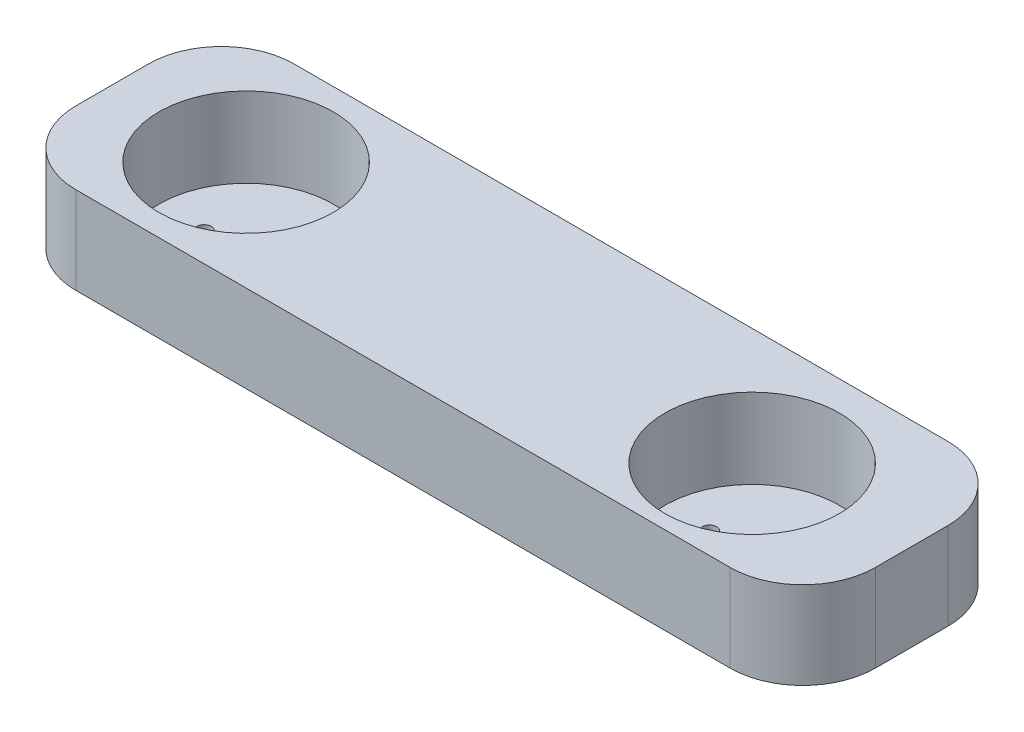
from build123d import *

# Parameters (mm, degrees)
SKETCH1_W           = 110
SKETCH1_H           = 30
BOSS_EXTRUDE1_DEPTH = 12
FILLET1_R           = 10
FILLET2_R           = 10
SKETCH9_R           = 12
CUT_EXTRUDE5_DEPTH  = 11
SKETCH13_R          = 12
CUT_EXTRUDE7_DEPTH  = 11
SKETCH15_R          = 3.43
SKETCH15_R_2        = 1
CUT_EXTRUDE8_DEPTH  = 123.394479271
SKETCH16_R          = 3.43
SKETCH16_R_2        = 1
CUT_EXTRUDE9_DEPTH  = 123.394479271


with BuildPart() as part:
    # Sketch1 → Boss-Extrude1 (new body)
    with BuildSketch(Plane(origin=(0, 0, 0), x_dir=(1, 0, 0), z_dir=(0, 1, 0))):
        with Locations((5.385430756, 3.53837453)):
            Rectangle(SKETCH1_W, SKETCH1_H)
    extrude(amount=BOSS_EXTRUDE1_DEPTH)

    # Fillet1
    fillet1_edges = [part.edges().sort_by_distance(p)[0] for p in [
        (-49.614569244, 6, -18.53837453),
        (-49.614569244, 6, 11.46162547),
    ]]
    fillet(fillet1_edges, radius=FILLET1_R)

    # Fillet2
    fillet2_edges = [part.edges().sort_by_distance(p)[0] for p in [
        (60.385430756, 6, -18.53837453),
        (60.385430756, 6, 11.46162547),
    ]]
    fillet(fillet2_edges, radius=FILLET2_R)

    # Sketch9 → Cut-Extrude5 (cut)
    with BuildSketch(Plane(origin=(0, 12, 0), x_dir=(1, 0, 0), z_dir=(0, 1, 0))):
        with Locations((-31.195762423, 3.53837453)):
            Circle(SKETCH9_R)
    extrude(amount=-CUT_EXTRUDE5_DEPTH, mode=Mode.SUBTRACT)

    # Sketch13 → Cut-Extrude7 (cut)
    with BuildSketch(Plane(origin=(70.696833098, 12, 1.072209922), x_dir=(1, 0, 0), z_dir=(0, 1, 0))):
        with Locations((-31.195762423, 3.53837453)):
            Circle(SKETCH13_R)
    extrude(amount=-CUT_EXTRUDE7_DEPTH, mode=Mode.SUBTRACT)

    # Sketch15 → Cut-Extrude8 (cut, through all)
    with BuildSketch(Plane(origin=(70.696833098, 1, 1.072209922), x_dir=(1, 0, 0), z_dir=(0, 1, 0))):
        with Locations((-31.147671482, 3.53837453)):
            Circle(SKETCH15_R)
        with Locations((-25.217671482, 3.53837453)):
            Circle(SKETCH15_R_2)
        with Locations((-37.077671482, 3.53837453)):
            Circle(SKETCH15_R_2)
    extrude(amount=-CUT_EXTRUDE8_DEPTH, mode=Mode.SUBTRACT)

    # Sketch16 → Cut-Extrude9 (cut, through all)
    with BuildSketch(Plane(origin=(70.696833098, 1, 1.072209922), x_dir=(1, 0, 0), z_dir=(0, 1, 0))):
        with Locations((-101.699594536, 4.556727145)):
            Circle(SKETCH16_R)
        with Locations((-95.769594536, 4.556727145)):
            Circle(SKETCH16_R_2)
        with Locations((-107.629594536, 4.556727145)):
            Circle(SKETCH16_R_2)
    extrude(amount=-CUT_EXTRUDE9_DEPTH, mode=Mode.SUBTRACT)


solid = part.part
